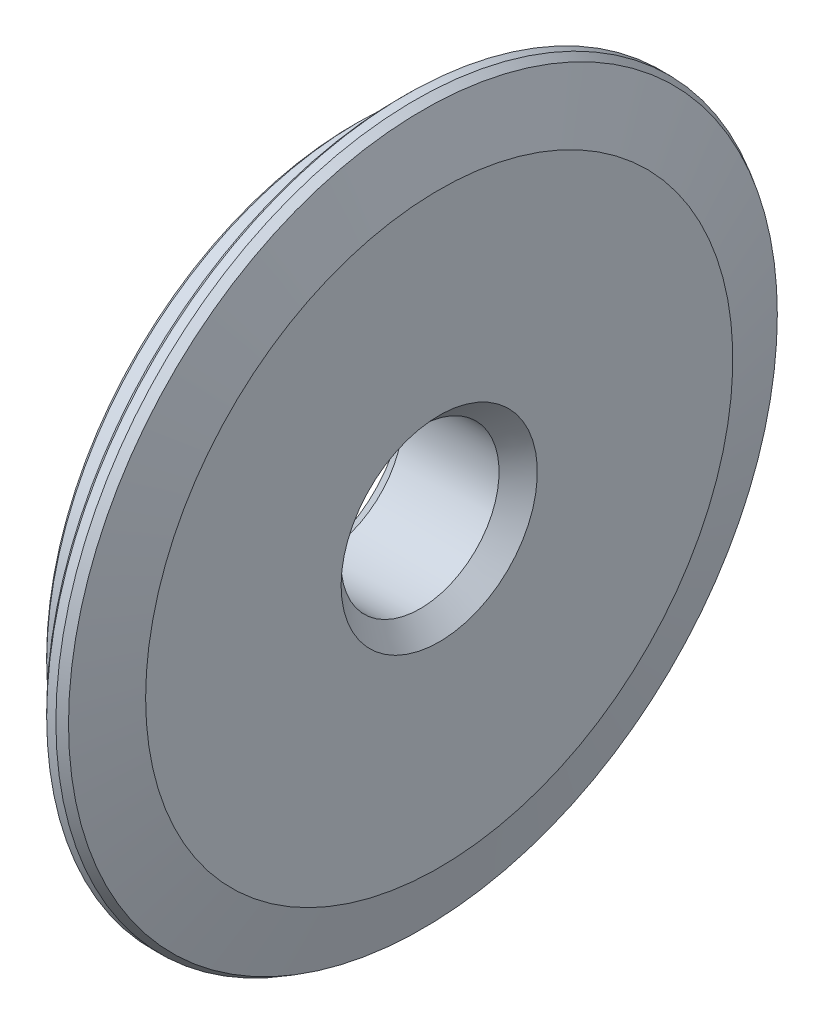
from build123d import *
from OCP.BRepFilletAPI import BRepFilletAPI_MakeChamfer

# Parameters (mm, degrees)
CHAMFER_1_SIZE  = 2
CHAMFER_2_SIZE  = 0.5
CHAMFER_2_SIZE2 = 0.707106781


with BuildPart() as part:
    # Эскиз1 → Повернуть1 (revolve)
    with BuildSketch(Plane.XY):
        Polygon((0, 8.25), (14, 8.25), (14, 30.664004605), (12.168300554, 37.5), (10, 37.5), (10, 32.5), (5, 32.5), (5, 30.5), (11, 30.5), (11, 12.5), (0, 12.5), align=None)
    revolve(axis=Axis((0, 0, 0), (1, 0, 0)))

    # Фаска1
    chamfer_1_edges = [part.edges().sort_by_distance(p)[0] for p in [
        (14, -8.25, 0),
        (0, -8.25, 0),
    ]]
    chamfer(chamfer_1_edges, length=CHAMFER_1_SIZE)

    # Фаска2: one chamfer whose edges measure the first distance from different faces: ONE call of the kernel's chamfer builder (chamfer() names one face for all edges)
    chamfer_2_edges_1 = [part.edges().sort_by_distance(p)[0] for p in [
        (12.168300554, -37.5, 0),
    ]]
    chamfer_2_side_1 = [part.faces().sort_by_distance(p)[0] for p in [
        (13.084150277, -34.082002303, 0),
    ]]
    chamfer_2_edges_2 = [part.edges().sort_by_distance(p)[0] for p in [
        (10, -37.5, 0),
        (5, -30.5, 0),
        (5, -32.5, 0),
    ]]
    chamfer_2 = BRepFilletAPI_MakeChamfer(part.part.solid().wrapped)
    for e in chamfer_2_edges_1:
        chamfer_2.Add(CHAMFER_2_SIZE, CHAMFER_2_SIZE2, e.wrapped, chamfer_2_side_1[0].wrapped)  # the first distance lies on this face
    for e in chamfer_2_edges_2:
        chamfer_2.Add(CHAMFER_2_SIZE, e.wrapped)
    add(Compound.cast(chamfer_2.Shape()), mode=Mode.REPLACE)


solid = part.part
